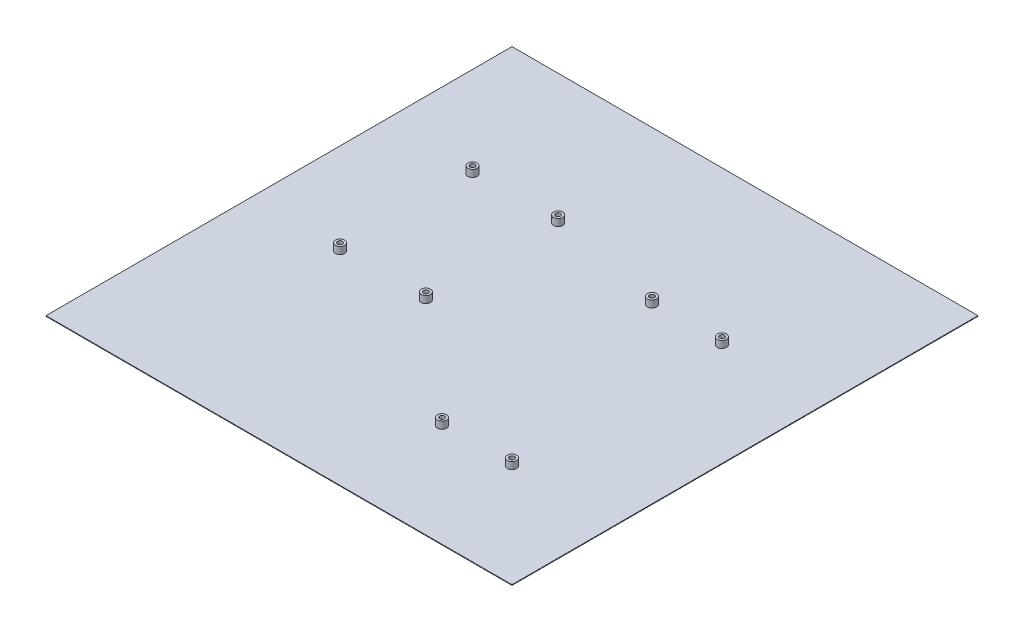
from build123d import *

# Parameters (mm, degrees)
SKETCH1_W           = 333
SKETCH1_H           = 333
BOSS_EXTRUDE1_DEPTH = 0.45
SKETCH7_R           = 3.3
BOSS_EXTRUDE2_DEPTH = 5
SKETCH8_R           = 1.75
CUT_EXTRUDE1_DEPTH  = 4
SKETCH6_R           = 3.3
BOSS_EXTRUDE3_DEPTH = 5
SKETCH10_R          = 1.75
CUT_EXTRUDE2_DEPTH  = 4


with BuildPart() as part:
    # Sketch1 → Boss-Extrude1 (new body)
    with BuildSketch(Plane(origin=(0, 0, 0), x_dir=(1, 0, 0), z_dir=(0, 1, 0))):
        Rectangle(SKETCH1_W, SKETCH1_H)
    extrude(amount=BOSS_EXTRUDE1_DEPTH)

    # Sketch7 → Boss-Extrude2 (add)
    with BuildSketch(Plane(origin=(0, 0.45, 0), x_dir=(1, 0, 0), z_dir=(0, 1, 0))):
        with Locations((-101.944122288, 73.718496611)):
            Circle(SKETCH7_R)
        with Locations((-40.944612394, 73.964266283)):
            Circle(SKETCH7_R)
        with Locations((-40.561856325, -21.03497585)):
            Circle(SKETCH7_R)
        with Locations((-101.561366219, -21.280745522)):
            Circle(SKETCH7_R)
    extrude(amount=BOSS_EXTRUDE2_DEPTH)

    # Sketch8 → Cut-Extrude1 (cut)
    with BuildSketch(Plane(origin=(0, 5.45, 0), x_dir=(1, 0, 0), z_dir=(0, 1, 0))):
        with Locations((-40.561856325, -21.03497585)):
            Circle(SKETCH8_R)
        with Locations((-40.944612394, 73.964266283)):
            Circle(SKETCH8_R)
        with Locations((-101.944122288, 73.718496611)):
            Circle(SKETCH8_R)
        with Locations((-101.561366219, -21.280745522)):
            Circle(SKETCH8_R)
    extrude(amount=-CUT_EXTRUDE1_DEPTH, mode=Mode.SUBTRACT)

    # Sketch6 → Boss-Extrude3 (add)
    with BuildSketch(Plane(origin=(0, 0.45, 0), x_dir=(1, 0, 0), z_dir=(0, 1, 0))):
        with Locations((93, 57)):
            Circle(SKETCH6_R)
        with Locations((43, 57)):
            Circle(SKETCH6_R)
        with Locations((93, -93)):
            Circle(SKETCH6_R)
        with Locations((43, -93)):
            Circle(SKETCH6_R)
    extrude(amount=BOSS_EXTRUDE3_DEPTH)

    # Sketch10 → Cut-Extrude2 (cut)
    with BuildSketch(Plane(origin=(0, 5.45, 0), x_dir=(1, 0, 0), z_dir=(0, 1, 0))):
        with Locations((43, 57)):
            Circle(SKETCH10_R)
        with Locations((93, 57)):
            Circle(SKETCH10_R)
        with Locations((93, -93)):
            Circle(SKETCH10_R)
        with Locations((43, -93)):
            Circle(SKETCH10_R)
    extrude(amount=-CUT_EXTRUDE2_DEPTH, mode=Mode.SUBTRACT)


solid = part.part
